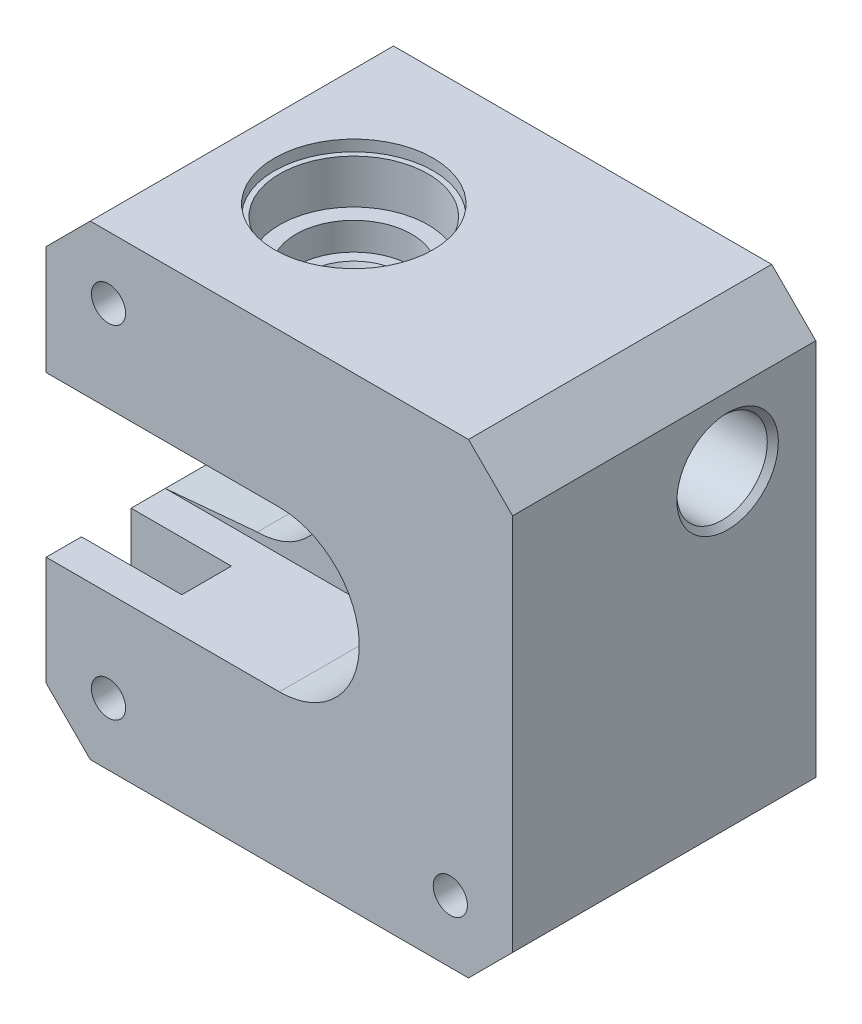
from build123d import *

# Parameters (mm, degrees)
CROQUIS1_W                  = 42.3
CROQUIS1_H                  = 42.3
SALIENTE_EXTRUIR1_DEPTH     = 28
CHAFL_N1_SIZE               = 4
CROQUIS5_W                  = 28.4
CROQUIS5_H                  = 14.5
CORTAR_EXTRUIR4_DEPTH       = 28
CROQUIS6_W                  = 5
CROQUIS6_H                  = 14.5
SALIENTE_EXTRUIR2_DEPTH     = 28.4
CORTAR_EXTRUIR5_REACH       = 64.109
CROQUIS3_R                  = 1.9
CORTAR_EXTRUIR2_DEPTH       = 67.049829674
CORTAR_EXTRUIR6_DEPTH       = 20
CROQUIS9_R                  = 1.55
CORTAR_EXTRUIR7_DEPTH       = 28
CROQUIS10_R                 = 6.725
CORTAR_EXTRUIR8_DEPTH       = 5
CROQUIS11_R                 = 5.25
CORTAR_EXTRUIR9_DEPTH       = 2.5
CROQUIS12_R                 = 3.25
CORTAR_EXTRUIR10_DEPTH      = 6
CROQUIS15_R                 = 7.2
CORTAR_EXTRUIR13_DEPTH      = 1
CHAFL_N2_SIZE               = 1
CHAFL_N2_SIZE2              = 1.732050808
CHAFL_N4_SIZE               = 1
CHAFL_N4_SIZE2              = 1.732050808
CHAFL_N5_SIZE               = 0.7
CHAFL_N5_SIZE2              = 1.212435565
CORTAR_EXTRUIR17_START      = -28.4
CORTAR_EXTRUIR17_DEPTH      = 13.9
CROQUIS21_W                 = 0.6029178
CROQUIS21_H                 = 4.2
CORTAR_EXTRUIR19_DEPTH      = 63.108534035
CROQUIS22_R                 = 2.5
CORTAR_EXTRUIR20_DEPTH      = 67.049829674
REDONDEO1_R                 = 0.4
CROQUIS25_W                 = 42.3
CROQUIS25_H                 = 0.5
CORTAR_EXTRUIR23_DEPTH      = 67.049829674
CROQUIS34_W                 = 1.8
CROQUIS34_H                 = 13.9
CROQUIS34_W_2               = 4.5
CORTAR_EXTRUIR28_DEPTH      = 9.1
REDONDEO6_START             = 5.5
REDONDEO6_DEPTH             = 22
REDONDEO6_2_DEPTH           = 10.464246
REDONDEO6_3_DEPTH           = 1.5
REDONDEO6_START_2           = 13.9
REDONDEO6_4_DEPTH           = 1.861113622
REDONDEO6_START_3           = 1.5
REDONDEO6_5_DEPTH           = 4
REDONDEO6_6_DEPTH           = 4
CORTAR_EXTRUIR29_DEPTH      = 3.9
REDONDEO7_R                 = 2
CROQUIS24_R                 = 4.1
CORTAR_EXTRUIR22_DEPTH      = 17
CHAFL_N7_SIZE               = 0.5
CORTAR_EXTRUIR30_START      = -3.1
CORTAR_EXTRUIR30_DEPTH      = 3.1
REDONDEO10_R                = 0.5
CORTAR_EXTRUIR35_DEPTH      = 62.872611065
CORTAR_EXTRUIR35_DEPTH_BACK = 62.872611065


with BuildPart() as part:
    # Croquis1 → Saliente-Extruir1 (new body)
    with BuildSketch(Plane.XY):
        with Locations((21.15, 21.15)):
            Rectangle(CROQUIS1_W, CROQUIS1_H)
    extrude(amount=SALIENTE_EXTRUIR1_DEPTH)

    # Chaflán1
    chafl_n1_edges = [part.edges().sort_by_distance(p)[0] for p in [
        (0, 42.3, 14),
        (42.3, 42.3, 14),
        (42.3, 0, 14),
        (0, 0, 14),
    ]]
    chamfer(chafl_n1_edges, length=CHAFL_N1_SIZE)

    # Croquis5 → Cortar-Extruir4 (cut)
    with BuildSketch(Plane.XY.offset(28)):
        with Locations((14.2, 21.15)):
            Rectangle(CROQUIS5_W, CROQUIS5_H)
    extrude(amount=-CORTAR_EXTRUIR4_DEPTH, mode=Mode.SUBTRACT)

    # Croquis6 → Saliente-Extruir2 (add)
    with BuildSketch(Plane.ZY):
        with Locations((14.2, 21.15)):
            Rectangle(CROQUIS6_W, CROQUIS6_H)
    extrude(amount=-SALIENTE_EXTRUIR2_DEPTH)

    # Croquis7 → Cortar-Extruir5 (cut, up to next)
    with BuildSketch(Plane.XY.offset(16.7), mode=Mode.PRIVATE) as cortar_extruir5_sk1:
        with BuildLine():
            Line((0, 27.65), (8.35, 27.65))
            ThreePointArc((8.35, 27.65), (12.577883631, 26.087104415), (14.772616289, 22.15))
            Line((14.772616289, 22.15), (14.828607748, 22.15))
            ThreePointArc((14.828607748, 22.15), (27.55, 21.15), (14.828607748, 20.15))
            Line((14.828607748, 20.15), (14.772616289, 20.15))
            ThreePointArc((14.772616289, 20.15), (12.577883631, 16.212895585), (8.35, 14.65))
            Line((8.35, 14.65), (0, 14.65))
            ThreePointArc((0, 14.65), (-6.5, 21.15), (0, 27.65))
        make_face()
    cortar_extruir5_tool1 = extrude(cortar_extruir5_sk1.sketch, amount=-CORTAR_EXTRUIR5_REACH, mode=Mode.PRIVATE) & part.part
    add(cortar_extruir5_tool1.solids().sort_by_distance((10.077992, 21.15, 16.7))[0], mode=Mode.SUBTRACT)

    # Croquis3 → Cortar-Extruir2 (cut, through all)
    with BuildSketch(Plane(origin=(0, 42.3, 0), x_dir=(1, 0, 0), z_dir=(0, 1, 0))):
        with Locations(Location((14.6, -14.2, 0), (0, 0, 270))):
            Circle(CROQUIS3_R)
    extrude(amount=-CORTAR_EXTRUIR2_DEPTH, mode=Mode.SUBTRACT)

    # Croquis8 → Cortar-Extruir6 (cut)
    with BuildSketch(Plane(origin=(0, 0, 11.7), x_dir=(-1, 0, 0), z_dir=(0, 0, -1))):
        Polygon((-8.35, 14.65), (0, 13.9), (0, 14.65), align=None)
        Polygon((0, 28.4), (-8.35, 27.65), (0, 27.65), align=None)
    extrude(amount=-CORTAR_EXTRUIR6_DEPTH, mode=Mode.SUBTRACT)

    # Croquis9 → Cortar-Extruir7 (cut)
    with BuildSketch(Plane(origin=(0, 0, 0), x_dir=(-1, 0, 0), z_dir=(0, 0, -1))):
        with Locations((-5.65, 36.65)):
            Circle(CROQUIS9_R)
        with Locations((-5.65, 5.65)):
            Circle(CROQUIS9_R)
        with Locations((-36.65, 5.65)):
            Circle(CROQUIS9_R)
    extrude(amount=-CORTAR_EXTRUIR7_DEPTH, mode=Mode.SUBTRACT)

    # Croquis10 → Cortar-Extruir8 (cut)
    with BuildSketch(Plane(origin=(0, 42.3, 0), x_dir=(1, 0, 0), z_dir=(0, 1, 0))):
        with Locations(Location((14.6, -14.2, 0), (0, 0, 270))):
            Circle(CROQUIS10_R)
    cortar_extruir8 = extrude(amount=-CORTAR_EXTRUIR8_DEPTH, mode=Mode.SUBTRACT)

    # Croquis11 → Cortar-Extruir9 (cut)
    with BuildSketch(Plane(origin=(0, 37.3, 0), x_dir=(1, 0, 0), z_dir=(0, 1, 0))):
        with Locations(Location((14.6, -14.2, 0), (0, 0, 270))):
            Circle(CROQUIS11_R)
    cortar_extruir9 = extrude(amount=-CORTAR_EXTRUIR9_DEPTH, mode=Mode.SUBTRACT)

    # Croquis12 → Cortar-Extruir10 (cut)
    with BuildSketch(Plane(origin=(0, 34.8, 0), x_dir=(1, 0, 0), z_dir=(0, 1, 0))):
        with Locations(Location((14.6, -14.2, 0), (0, 0, 270))):
            Circle(CROQUIS12_R)
    cortar_extruir10 = extrude(amount=-CORTAR_EXTRUIR10_DEPTH, mode=Mode.SUBTRACT)

    # Croquis15 → Cortar-Extruir13 (cut)
    with BuildSketch(Plane(origin=(0, 42.3, 0), x_dir=(1, 0, 0), z_dir=(0, 1, 0))):
        with Locations(Location((14.6, -14.2, 0), (0, 0, 270))):
            Circle(CROQUIS15_R)
    cortar_extruir13 = extrude(amount=-CORTAR_EXTRUIR13_DEPTH, mode=Mode.SUBTRACT)

    # Chaflán2
    chafl_n2_edges = [part.edges().sort_by_distance(p)[0] for p in [
        (14.6, 34.8, 10.95),
    ]]
    chafl_n2_side = [part.faces().sort_by_distance(p)[0] for p in [
        (14.6, 34.8, 9.098492424),
    ]]
    chamfer(chafl_n2_edges, length=CHAFL_N2_SIZE, length2=CHAFL_N2_SIZE2, reference=chafl_n2_side[0])

    # Simetría1: Cortar-Extruir8, Cortar-Extruir9, Cortar-Extruir10, Cortar-Extruir13 across plane
    add(cortar_extruir8.mirror(Plane.ZX.offset(21.15)), mode=Mode.SUBTRACT)
    add(cortar_extruir9.mirror(Plane.ZX.offset(21.15)), mode=Mode.SUBTRACT)
    add(cortar_extruir10.mirror(Plane.ZX.offset(21.15)), mode=Mode.SUBTRACT)
    add(cortar_extruir13.mirror(Plane.ZX.offset(21.15)), mode=Mode.SUBTRACT)

    # Chaflán4
    chafl_n4_edges = [part.edges().sort_by_distance(p)[0] for p in [
        (14.6, 7.5, 10.95),
    ]]
    chafl_n4_side = [part.faces().sort_by_distance(p)[0] for p in [
        (14.6, 7.5, 9.098492424),
    ]]
    chamfer(chafl_n4_edges, length=CHAFL_N4_SIZE, length2=CHAFL_N4_SIZE2, reference=chafl_n4_side[0])

    # Chaflán5
    chafl_n5_edges = [part.edges().sort_by_distance(p)[0] for p in [
        (14.6, 13.5, 12.3),
    ]]
    chafl_n5_side = [part.faces().sort_by_distance(p)[0] for p in [
        (14.6, 13.5, 11.041923882),
    ]]
    chamfer(chafl_n5_edges, length=CHAFL_N5_SIZE, length2=CHAFL_N5_SIZE2, reference=chafl_n5_side[0])

    # Croquis18 → Cortar-Extruir17 (cut)
    with BuildSketch(Plane(origin=(0, 42.3, 0), x_dir=(1, 0, 0), z_dir=(0, 1, 0)).offset(CORTAR_EXTRUIR17_START)):
        with BuildLine():
            Line((12, -5.5), (24, -5.5))
            ThreePointArc((24, -5.5), (26, -3.5), (24, -1.5))
            Line((24, -1.5), (12, -1.5))
            ThreePointArc((12, -1.5), (10, -3.5), (12, -5.5))
        make_face()
    extrude(amount=-CORTAR_EXTRUIR17_DEPTH, mode=Mode.SUBTRACT)

    # Croquis21 → Cortar-Extruir19 (cut, through all)
    with BuildSketch(Plane.XY.offset(16.7)):
        with Locations((14.8028815, 21.15)):
            Rectangle(CROQUIS21_W, CROQUIS21_H)
    extrude(amount=-CORTAR_EXTRUIR19_DEPTH, mode=Mode.SUBTRACT)

    # Croquis22 → Cortar-Extruir20 (cut, through all)
    with BuildSketch(Plane.ZY):
        with Locations(Location((8, 32.05, 0), (0, 0, 270))):
            Circle(CROQUIS22_R)
    extrude(amount=-CORTAR_EXTRUIR20_DEPTH, mode=Mode.SUBTRACT)

    # Redondeo1
    # the kernel refuses this fillet: 0.4 mm, written as the material it takes off along each edge
    with BuildSketch(Plane(origin=(14.5014226, 19.05, 13.001937654), x_dir=(1, 0, 0), z_dir=(0, 0, -1))) as redondeo1_piece_1:
        with BuildLine():
            CenterArc((0.279751477, 0.4), REDONDEO1_R, 201.242672427, 68.757327573)
            ThreePointArc((-0.093070209, 0.255072464), (-0.04520308, 0.128022258), (0, 0))
            Line((0, 0), (0.279751477, 0))
        make_face()
    extrude(amount=2.001316345, mode=Mode.SUBTRACT)
    with BuildSketch(Plane(origin=(15.1043404, 19.05, 13.063421956), x_dir=(0.3479633367587748, -0.9375081419762173, 0), z_dir=(0, 0, -1))) as redondeo1_piece_2:
        with BuildLine():
            CenterArc((0.278232878, 0.399911132), REDONDEO1_R, 200.362794187, 68.429421699)
            Line((-0.096770379, 0.260725797), (0, 0))
            ThreePointArc((0, 0), (0.134900789, 0.001421894), (0.269801578, 0))
        make_face()
    extrude(amount=2.058684709, mode=Mode.SUBTRACT)
    with BuildSketch(Plane(origin=(15.1043404, 19.05, 17.395262754), x_dir=(-1, 0, 0), z_dir=(0, 0, -1))) as redondeo1_piece_3:
        with BuildLine():
            CenterArc((0.278105101, -0.4), REDONDEO1_R, 90, 68.429421698)
            ThreePointArc((-0.093881057, -0.252941176), (-0.045607491, -0.126965355), (0, 0))
            Line((0, 0), (0.278105101, 0))
        make_face()
    extrude(amount=2.058684708, mode=Mode.SUBTRACT)
    with BuildSketch(Plane(origin=(14.5014226, 19.05, 17.399378692), x_dir=(1, 0, 0), z_dir=(0, 0, -1))) as redondeo1_piece_4:
        with BuildLine():
            CenterArc((0.279751477, 0.4), REDONDEO1_R, 201.242672427, 68.757327573)
            ThreePointArc((-0.093070209, 0.255072464), (-0.04520308, 0.128022258), (0, 0))
            Line((0, 0), (0.279751477, 0))
        make_face()
    extrude(amount=2.001316321, mode=Mode.SUBTRACT)
    with BuildSketch(Plane(origin=(15.1043404, 23.25, 17.395262754), x_dir=(0.34796333675886587, 0.9375081419761836, 0), z_dir=(0, 0, -1))) as redondeo1_piece_5:
        with BuildLine():
            CenterArc((0.278232878, -0.399911132), REDONDEO1_R, 91.207784114, 68.429421699)
            Line((-0.096770379, -0.260725797), (0, 0))
            ThreePointArc((0, 0), (0.134900789, -0.001421894), (0.269801578, 0))
        make_face()
    extrude(amount=2.058684708, mode=Mode.SUBTRACT)
    with BuildSketch(Plane(origin=(15.1043404, 23.25, 13.063421956), x_dir=(0.34796333675886587, 0.9375081419761836, 0), z_dir=(0, 0, -1))) as redondeo1_piece_6:
        with BuildLine():
            CenterArc((0.278232878, -0.399911132), REDONDEO1_R, 91.207784114, 68.429421699)
            Line((-0.096770379, -0.260725797), (0, 0))
            ThreePointArc((0, 0), (0.134900789, -0.001421894), (0.269801578, 0))
        make_face()
    extrude(amount=2.058684709, mode=Mode.SUBTRACT)
    with BuildSketch(Plane(origin=(14.5014226, 23.25, 13.001937654), x_dir=(1, 0, 0), z_dir=(0, 0, -1))) as redondeo1_piece_7:
        with BuildLine():
            CenterArc((0.279751477, -0.4), REDONDEO1_R, 90, 68.757327573)
            ThreePointArc((-0.093070209, -0.255072464), (-0.04520308, -0.128022258), (0, 0))
            Line((0, 0), (0.279751477, 0))
        make_face()
    extrude(amount=2.001316345, mode=Mode.SUBTRACT)
    with BuildSketch(Plane(origin=(14.5014226, 23.25, 17.399378692), x_dir=(1, 0, 0), z_dir=(0, 0, -1))) as redondeo1_piece_8:
        with BuildLine():
            CenterArc((0.279751477, -0.4), REDONDEO1_R, 90, 68.757327573)
            ThreePointArc((-0.093070209, -0.255072464), (-0.04520308, -0.128022258), (0, 0))
            Line((0, 0), (0.279751477, 0))
        make_face()
    extrude(amount=2.001316321, mode=Mode.SUBTRACT)

    # Croquis25 → Cortar-Extruir23 (cut, through all)
    with BuildSketch(Plane(origin=(0, 42.3, 0), x_dir=(1, 0, 0), z_dir=(0, 1, 0))):
        with Locations((21.15, -27.75)):
            Rectangle(CROQUIS25_W, CROQUIS25_H)
    extrude(amount=-CORTAR_EXTRUIR23_DEPTH, mode=Mode.SUBTRACT)

    # Croquis34 → Cortar-Extruir28 (cut)
    with BuildSketch(Plane.ZY):
        with Locations((0.9, 6.95)):
            Rectangle(CROQUIS34_W, CROQUIS34_H)
        with Locations((22.05, 6.95)):
            Rectangle(CROQUIS34_W_2, CROQUIS34_H)
    extrude(amount=-CORTAR_EXTRUIR28_DEPTH, mode=Mode.SUBTRACT)

    # Redondeo6: read off the stored shape, not the designer's step
    # Redondeo6 outline → Redondeo6 (add)
    with BuildSketch(Plane.XY.offset(REDONDEO6_START)):
        with BuildLine():
            Line((28.4, 13.9), (28.4, 21.15))
            ThreePointArc((28.4, 21.15), (26.276524164, 16.023475836), (21.15, 13.9))
            Line((21.15, 13.9), (28.4, 13.9))
        make_face()
        with BuildLine():
            ThreePointArc((21.15, 28.4), (26.276524164, 26.276524164), (28.4, 21.15))
            Line((28.4, 21.15), (28.4, 28.4))
            Line((28.4, 28.4), (21.15, 28.4))
        make_face()
    extrude(amount=REDONDEO6_DEPTH)

    # Redondeo6 2 outline → Redondeo6 2 (add)
    with BuildSketch(Plane.XY):
        with BuildLine():
            ThreePointArc((21.15, 28.4), (26.276524164, 26.276524164), (28.4, 21.15))
            Line((28.4, 21.15), (28.4, 28.4))
            Line((28.4, 28.4), (21.15, 28.4))
        make_face()
    extrude(amount=REDONDEO6_2_DEPTH)

    # Redondeo6 3 outline → Redondeo6 3 (add)
    with BuildSketch(Plane.XY):
        with BuildLine():
            Line((28.4, 13.9), (28.4, 21.15))
            ThreePointArc((28.4, 21.15), (26.276524164, 16.023475836), (21.15, 13.9))
            Line((21.15, 13.9), (28.4, 13.9))
        make_face()
    extrude(amount=REDONDEO6_3_DEPTH)

    # Redondeo6 4 outline → Redondeo6 4 (add)
    with BuildSketch(Plane(origin=(0, 0, 0), x_dir=(1, 0, 0), z_dir=(0, 1, 0)).offset(REDONDEO6_START_2)):
        with BuildLine():
            ThreePointArc((24, -1.5), (26, -3.5), (24, -5.5))
            Line((24, -5.5), (28.4, -5.5))
            Line((28.4, -5.5), (28.4, -1.5))
            Line((28.4, -1.5), (24, -1.5))
        make_face()
    extrude(amount=REDONDEO6_4_DEPTH)

    # Redondeo6 5 outline → Redondeo6 5 (cut)
    with BuildSketch(Plane.XY.offset(REDONDEO6_START_3)):
        with BuildLine():
            ThreePointArc((23, 14.140007132), (24.596659727, 14.771674457), (25.999990063, 15.761113622))
            Line((25.999990063, 15.761113622), (23, 15.761113622))
            Line((23, 15.761113622), (23, 14.140007132))
        make_face()
    extrude(amount=REDONDEO6_5_DEPTH, mode=Mode.SUBTRACT)

    # Redondeo6 6 outline → Redondeo6 6 (add)
    with BuildSketch(Plane.XY.offset(REDONDEO6_START_3)):
        with BuildLine():
            Line((28.4, 15.761113622), (28.4, 21.15))
            ThreePointArc((28.4, 21.15), (27.772874299, 18.200417653), (25.999990063, 15.761113622))
            Line((25.999990063, 15.761113622), (28.4, 15.761113622))
        make_face()
    extrude(amount=REDONDEO6_6_DEPTH)

    # Croquis35 → Cortar-Extruir29 (cut)
    with BuildSketch(Plane.ZY):
        with BuildLine():
            Line((24.7, 27.4), (24.7, 29.15))
            ThreePointArc((24.7, 29.15), (22.21040764, 35.16040764), (16.2, 37.65))
            Line((16.2, 37.65), (12.7, 37.65))
            Line((12.7, 37.65), (12.7, 42.3))
            Line((12.7, 42.3), (0, 42.3))
            Line((0, 42.3), (0, 27.4))
            Line((0, 27.4), (24.7, 27.4))
        make_face()
    extrude(amount=-CORTAR_EXTRUIR29_DEPTH, mode=Mode.SUBTRACT)

    # Redondeo7
    redondeo7_edges = [part.edges().sort_by_distance(p)[0] for p in [
        (1.95, 37.65, 12.7),
    ]]
    fillet(redondeo7_edges, radius=REDONDEO7_R)

    # Croquis24 → Cortar-Extruir22 (cut)
    with BuildSketch(Plane(origin=(42.3, 0, 0), x_dir=(0, 0, -1), z_dir=(1, 0, 0))):
        with Locations(Location((-8, 32.05, 0), (0, 0, 90))):
            Circle(CROQUIS24_R)
    extrude(amount=-CORTAR_EXTRUIR22_DEPTH, mode=Mode.SUBTRACT)

    # Chaflán7
    chafl_n7_edges = [part.edges().sort_by_distance(p)[0] for p in [
        (42.3, 27.95, 8),
    ]]
    chamfer(chafl_n7_edges, length=CHAFL_N7_SIZE)

    # Cortar-Extruir30: read off the stored shape, not the designer's step
    # Cortar-Extruir30 outline → Cortar-Extruir30 (cut)
    with BuildSketch(Plane(origin=(0, 0, 0), x_dir=(-1, 0, 0), z_dir=(0, 0, -1)).offset(CORTAR_EXTRUIR30_START)):
        with BuildLine():
            ThreePointArc((-31.049494937, 35.299494937), (-34.054698757, 34.054698757), (-35.299494937, 31.049494937))
            Line((-35.299494937, 31.049494937), (-35.299494937, 11.250505063))
            ThreePointArc((-35.299494937, 11.250505063), (-31.049494937, 7.000505063), (-26.799494937, 11.250505063))
            Line((-26.799494937, 11.250505063), (-26.799494937, 16.606245279))
            ThreePointArc((-26.799494937, 16.606245279), (-27.988177327, 18.741301004), (-28.4, 21.15))
            ThreePointArc((-28.4, 21.15), (-26.276524164, 26.276524164), (-21.15, 28.4))
            Line((-21.15, 28.4), (-7.000505063, 28.4))
            Line((-7.000505063, 28.4), (-7.000505063, 31.049494937))
            ThreePointArc((-7.000505063, 31.049494937), (-8.245301243, 34.054698757), (-11.250505063, 35.299494937))
            Line((-11.250505063, 35.299494937), (-31.049494937, 35.299494937))
        make_face()
    extrude(amount=CORTAR_EXTRUIR30_DEPTH, mode=Mode.SUBTRACT)

    # Redondeo10
    # the kernel refuses this fillet: 0.5 mm, written as the material it takes off along each edge
    with BuildSketch(Plane(origin=(26.799494937, 16.606245279, 3.1), x_dir=(0, -1, 0), z_dir=(0, 0, -1))) as redondeo10_piece_1:
        with BuildLine():
            CenterArc((1.248067264, 0.5), REDONDEO10_R, 138.359781707, 131.640218293)
            ThreePointArc((0.874401329, 0.83222548), (0.454551629, 0.397882457), (0, 0))
            Line((0, 0), (1.248067264, 0))
        make_face()
    extrude(amount=1.6, mode=Mode.SUBTRACT)
    with BuildSketch(Plane(origin=(26.799494937, 16.606245279, 1.5), x_dir=(-0.6894215654155046, -0.7243603420536183, 0), z_dir=(0, 0, -1))) as redondeo10_piece_2:
        with BuildLine():
            CenterArc((1.248761213, -0.498264316), REDONDEO10_R, 94.77544353, 131.640218285)
            Line((0.90405043, -0.860444487), (0, 0))
            ThreePointArc((0, 0), (0.603567919, -0.025167423), (1.207135839, 0))
        make_face()
    extrude(amount=4.620168159, mode=Mode.SUBTRACT)

    # Croquis38 → Cortar-Extruir35 (cut, two sides: drawn at the far end of the back side and taken through both)
    with BuildSketch(Plane(origin=(0, 0, 11.7), x_dir=(-1, 0, 0), z_dir=(0, 0, -1)).offset(-CORTAR_EXTRUIR35_DEPTH_BACK)):
        with BuildLine():
            Line((-22, 27.55), (-21.15, 27.55))
            ThreePointArc((-21.15, 27.55), (-14.75, 21.15), (-21.15, 14.75))
            Line((-21.15, 14.75), (-22, 14.75))
            ThreePointArc((-22, 14.75), (-28.4, 21.15), (-22, 27.55))
        make_face()
    extrude(amount=CORTAR_EXTRUIR35_DEPTH + CORTAR_EXTRUIR35_DEPTH_BACK, mode=Mode.SUBTRACT)


solid = part.part
